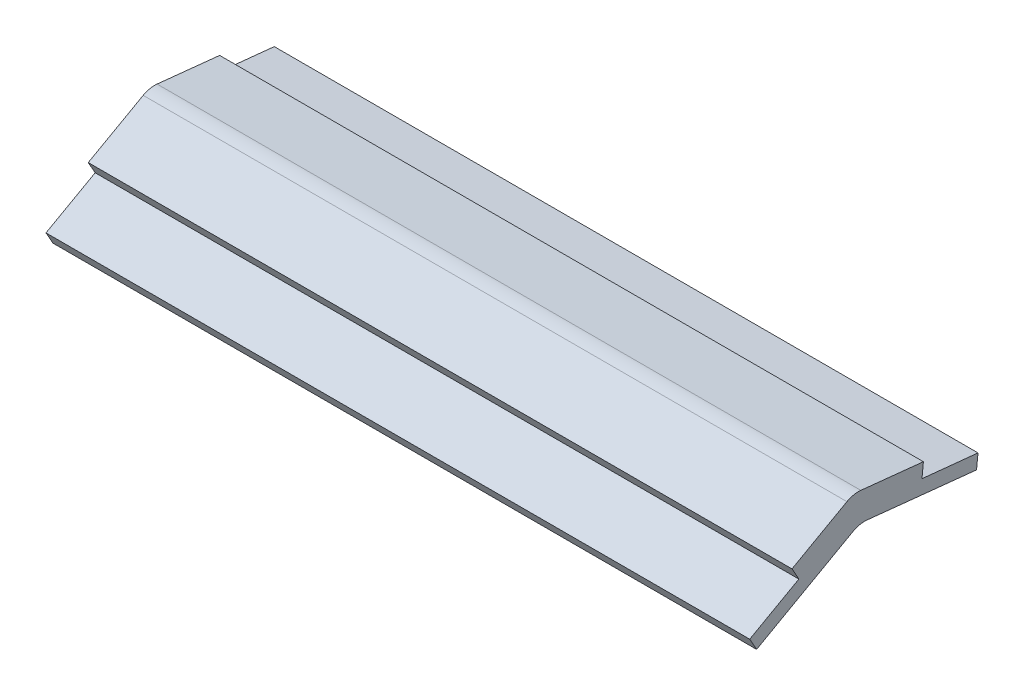
from build123d import *

# Parameters (mm, degrees)
BOSS_EXTRUDE1_DEPTH = 150


with BuildPart() as part:
    # Sketch1 → Boss-Extrude1 (new body)
    with BuildSketch(Plane(origin=(0, 0, 0), x_dir=(0, 0, -1), z_dir=(1, 0, 0))):
        with BuildLine():
            Line((-17.045147988, 11.09483048), (-15.580534174, 8.476642867))
            Line((-15.580534174, 8.476642867), (-26.053284627, 2.618187613))
            Line((-26.053284627, 2.618187613), (-24.588670814, 0))
            Line((-24.588670814, 0), (-4.018503161, 11.506949134))
            ThreePointArc((-4.018503161, 11.506949134), (-2.587030391, 12.04032346), (-1.061322063, 12.116589836))
            Line((-1.061322063, 12.116589836), (22.293012913, 9.692734292))
            Line((22.293012913, 9.692734292), (22.602707758, 12.676706326))
            Line((22.602707758, 12.676706326), (10.663660929, 13.884663612))
            Line((10.663660929, 13.884663612), (10.965650251, 16.86942532))
            Line((10.965650251, 16.86942532), (-2.379077071, 18.254422638))
            ThreePointArc((-2.379077071, 18.254422638), (-3.904785399, 18.178156261), (-5.336258169, 17.644781935))
            Line((-5.336258169, 17.644781935), (-17.045147988, 11.09483048))
        make_face()
    extrude(amount=BOSS_EXTRUDE1_DEPTH)


solid = part.part
